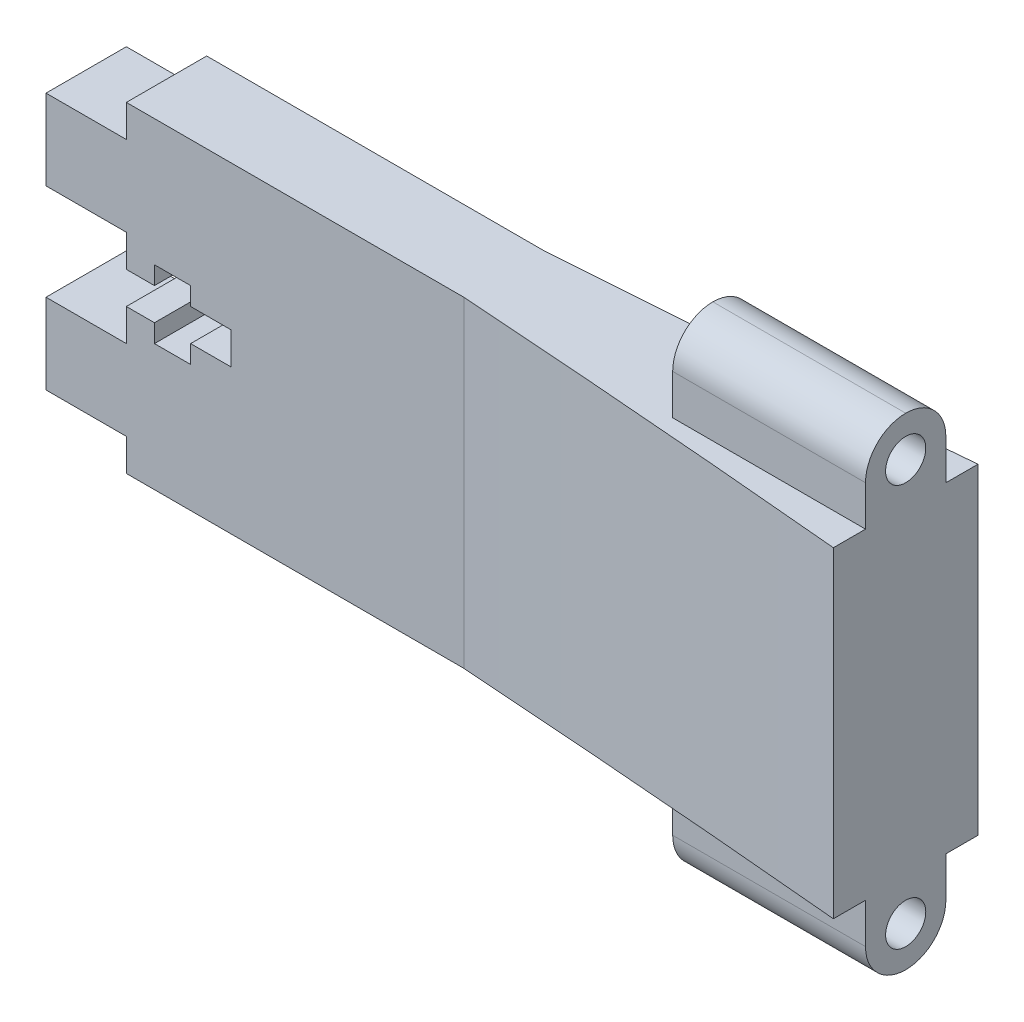
from build123d import *

# Parameters (mm, degrees)
BOSS_EXTRUDE1_DEPTH         = 5
SKETCH2_R                   = 2.5
CUT_EXTRUDE1_DEPTH          = 84.719770664
SKETCH3_R                   = 2.5
CUT_EXTRUDE2_DEPTH          = 84.719770664
FILLET1_R                   = 5
Y_KSEKLIK_EKSTR_ZYON1_DEPTH = 20


with BuildPart() as part:
    # Sketch1 → Boss-Extrude1 (new, symmetric)
    with BuildSketch(Plane.XY):
        Polygon((-42.5, 4.25), (-38, 4.25), (-38, 2), (-33, 2), (-33, -2), (-38, -2), (-38, -4.25), (-42.5, -4.25), (-42.5, -2), (-46, -2), (-46, -6), (-56, -6), (-56, -16), (-46, -16), (-46, -20), (22, -20), (22, -30), (46, -30), (46, -20), (46, -16), (46, -6), (46, -2), (46, 2), (46, 6), (46, 16), (46, 20), (46, 30), (22, 30), (22, 20), (-46, 20), (-46, 16), (-56, 16), (-56, 6), (-46, 6), (-46, 2), (-42.5, 2), align=None)
    extrude(amount=BOSS_EXTRUDE1_DEPTH, both=True)

    # Sketch2 → Cut-Extrude1 (cut, through all)
    with BuildSketch(Plane.ZY.offset(-22)):
        with Locations(Location((0, -25, 0), (0, 0, 270))):
            Circle(SKETCH2_R)
    extrude(amount=-CUT_EXTRUDE1_DEPTH, mode=Mode.SUBTRACT)

    # Sketch3 → Cut-Extrude2 (cut, through all)
    with BuildSketch(Plane.ZY.offset(-22)):
        with Locations((0, 25)):
            Circle(SKETCH3_R)
    extrude(amount=-CUT_EXTRUDE2_DEPTH, mode=Mode.SUBTRACT)

    # Fillet1
    fillet1_edges = [part.edges().sort_by_distance(p)[0] for p in [
        (34, -30, 5),
        (34, -30, -5),
        (34, 30, 5),
        (34, 30, -5),
    ]]
    fillet(fillet1_edges, radius=FILLET1_R - 0.0001)  # a hair under: the kernel refuses the full size

    # Çizim2 → Yükseklik-Ekstrüzyon1 (add, symmetric)
    with BuildSketch(Plane(origin=(0, 0, 0), x_dir=(1, 0, 0), z_dir=(0, 1, 0))):
        with BuildLine():
            Line((46, 5), (-4, 5))
            add(Edge.make_bspline(
                [(-4, 5), (21.025086812, 6.697636519), (46, 9)],
                knots=[0, 0, 0, 1, 1, 1], degree=2))
            Line((46, 9), (46, 5))
        make_face()
    y_kseklik_ekstr_zyon1 = extrude(amount=Y_KSEKLIK_EKSTR_ZYON1_DEPTH, both=True)

    # Mirror1: Yükseklik-Ekstrüzyon1 across plane
    add(y_kseklik_ekstr_zyon1.mirror(Plane.XY))


solid = part.part
